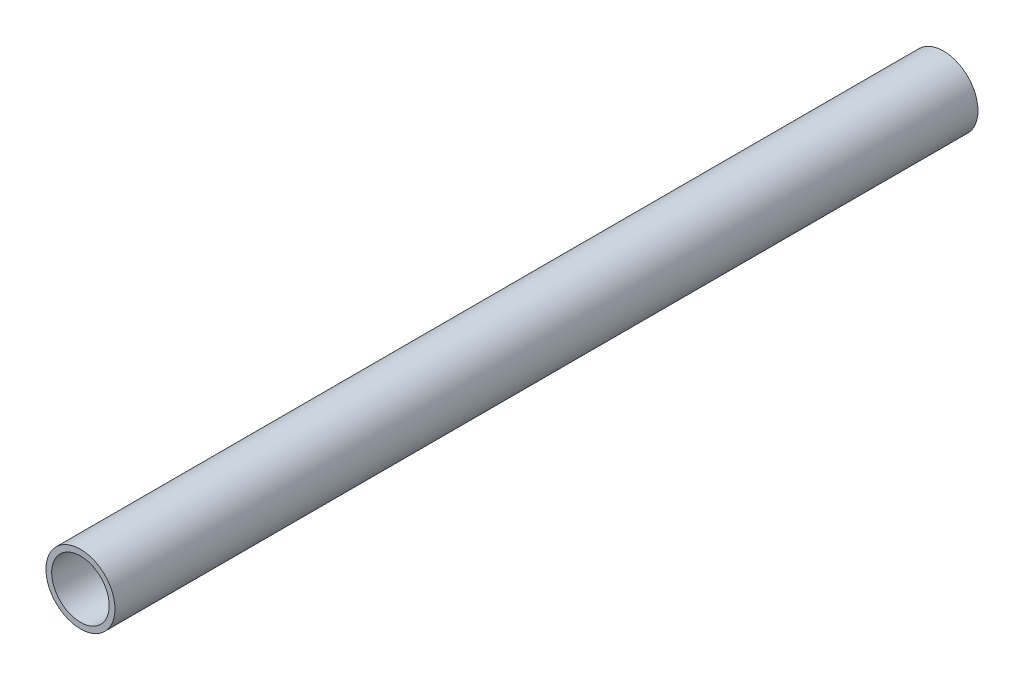
from build123d import *

# Parameters (mm, degrees)
CROQUIS1_R              = 6
CROQUIS1_R_2            = 5
SALIENTE_EXTRUIR1_DEPTH = 75


with BuildPart() as part:
    # Croquis1 → Saliente-Extruir1 (new, symmetric)
    with BuildSketch(Plane.XY):
        Circle(CROQUIS1_R)
        Circle(CROQUIS1_R_2, mode=Mode.SUBTRACT)
    extrude(amount=SALIENTE_EXTRUIR1_DEPTH, both=True)


solid = part.part
